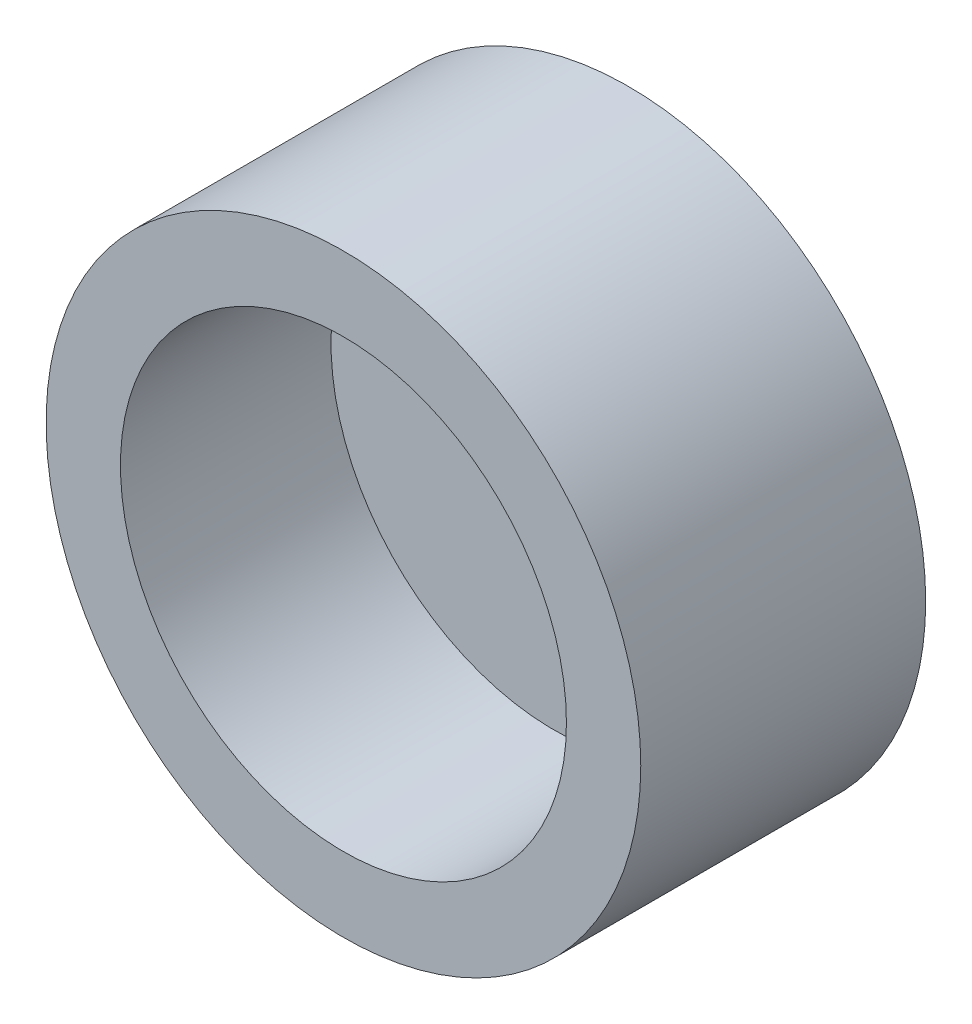
from build123d import *

# Parameters (mm, degrees)
SKETCH1_R           = 12
SKETCH1_R_2         = 9
BOSS_EXTRUDE1_DEPTH = 8.5
BOSS_EXTRUDE2_START = -3
SKETCH1_2_R         = 12
BOSS_EXTRUDE2_DEPTH = 3
SKETCH2_R           = 3.5
CUT_EXTRUDE1_DEPTH  = 2.5


with BuildPart() as part:
    # Sketch1 → Boss-Extrude1 (new body)
    with BuildSketch(Plane.XY):
        Circle(SKETCH1_R)
        Circle(SKETCH1_R_2, mode=Mode.SUBTRACT)
    extrude(amount=BOSS_EXTRUDE1_DEPTH)

    # Sketch1<2> → Boss-Extrude2 (add)
    with BuildSketch(Plane.XY.offset(BOSS_EXTRUDE2_START)):
        Circle(SKETCH1_2_R)
    extrude(amount=BOSS_EXTRUDE2_DEPTH)

    # Sketch2 → Cut-Extrude1 (cut)
    with BuildSketch(Plane(origin=(0, 0, -3), x_dir=(-1, 0, 0), z_dir=(0, 0, -1))):
        Circle(SKETCH2_R)
    extrude(amount=-CUT_EXTRUDE1_DEPTH, mode=Mode.SUBTRACT)


solid = part.part
